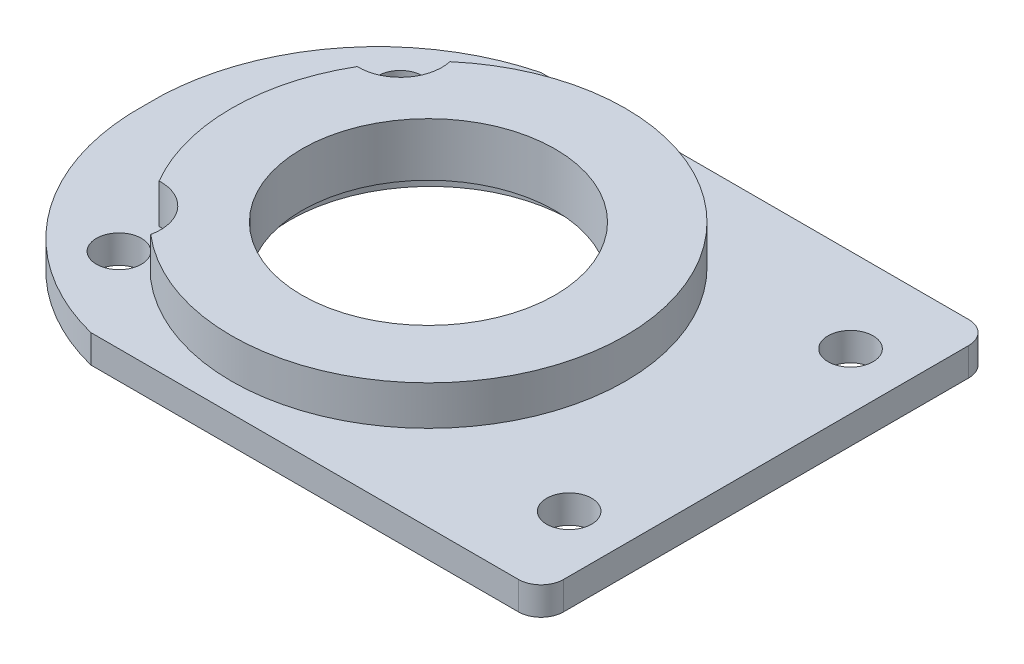
from build123d import *

# Parameters (mm, degrees)
SKETCH1_W               = 76.2
SKETCH1_H               = 50.8
SKETCH1_R               = 14.2748
BOSS_EXTRUDE1_DEPTH     = 3.175
SKETCH2_R               = 22.225
BOSS_EXTRUDE2_DEPTH     = 4.445
SKETCH4_R               = 15.8623
CUT_EXTRUDE2_DEPTH      = 1.6002
FILLET2_R               = 2.54
CUT_EXTRUDE3_DEPTH      = 92.688810795
CUT_EXTRUDE3_DEPTH_BACK = 92.688810795
SKETCH5_R               = 2.54
CUT_EXTRUDE4_DEPTH      = 92.688810795
SKETCH7_R               = 4.699
CUT_EXTRUDE5_DEPTH      = 92.688810795
SKETCH9_R               = 4.699
CUT_EXTRUDE6_DEPTH      = 92.688810795
CUT_EXTRUDE8_DEPTH      = 92.688810795
CUT_EXTRUDE8_DEPTH_BACK = 92.688810795
SKETCH3_R               = 14.2875


with BuildPart() as part:
    # Sketch1 → Boss-Extrude1 (new body)
    with BuildSketch(Plane(origin=(0, 0, 0), x_dir=(1, 0, 0), z_dir=(0, 1, 0))):
        with Locations((38.1, 25.4)):
            Rectangle(SKETCH1_W, SKETCH1_H)
        with Locations((38.1, 25.4)):
            Circle(SKETCH1_R, mode=Mode.SUBTRACT)
    extrude(amount=BOSS_EXTRUDE1_DEPTH)

    # Sketch2 → Boss-Extrude2 (add)
    with BuildSketch(Plane(origin=(0, 3.175, 0), x_dir=(1, 0, 0), z_dir=(0, 1, 0))):
        with Locations((38.1, 25.4)):
            Circle(SKETCH2_R)
    extrude(amount=BOSS_EXTRUDE2_DEPTH)

    # Sketch4 → Cut-Extrude2 (cut)
    with BuildSketch(Plane(origin=(0, 0, 0), x_dir=(-1, 0, 0), z_dir=(0, -1, 0))):
        with Locations((-38.332507849, 25.4)):
            Circle(SKETCH4_R)
    extrude(amount=-CUT_EXTRUDE2_DEPTH, mode=Mode.SUBTRACT)

    # Fillet2
    fillet2_edges = [part.edges().sort_by_distance(p)[0] for p in [
        (0, 1.5875, -50.8),
        (76.2, 1.5875, -50.8),
        (0, 1.5875, 0),
        (76.2, 1.5875, 0),
    ]]
    fillet(fillet2_edges, radius=FILLET2_R)

    # Sketch5 → Cut-Extrude3 (cut, two sides: drawn at the far end of the back side and taken through both)
    with BuildSketch(Plane(origin=(0, 3.175, 0), x_dir=(1, 0, 0), z_dir=(0, 1, 0)).offset(-CUT_EXTRUDE3_DEPTH_BACK)):
        with Locations((69.85, 41.275)):
            Circle(SKETCH5_R)
        with Locations((69.85, 9.525)):
            Circle(SKETCH5_R)
        with Locations((19.05, 9.525)):
            Circle(SKETCH5_R)
        with Locations((19.05, 41.275)):
            Circle(SKETCH5_R)
    extrude(amount=CUT_EXTRUDE3_DEPTH + CUT_EXTRUDE3_DEPTH_BACK, mode=Mode.SUBTRACT)

    # Sketch6 → Cut-Extrude4 (cut, through all)
    with BuildSketch(Plane(origin=(0, 3.175, 0), x_dir=(1, 0, 0), z_dir=(0, 1, 0))):
        with BuildLine():
            Line((0, 48.26), (0, 2.54))
            ThreePointArc((0, 2.54), (0.743948776, 0.743948776), (2.54, 0))
            Line((2.54, 0), (25.399999995, 0))
            ThreePointArc((25.399999995, 0), (11.359611147, 9.31110396), (6.233986574, 25.359691084))
            ThreePointArc((6.233986574, 25.359691084), (11.333824667, 41.457338196), (25.399999042, 50.8))
            Line((25.399999042, 50.8), (2.54, 50.8))
            ThreePointArc((2.54, 50.8), (0.743948776, 50.056051224), (0, 48.26))
        make_face()
    extrude(amount=-CUT_EXTRUDE4_DEPTH, mode=Mode.SUBTRACT)

    # Sketch7 → Cut-Extrude5 (cut, through all)
    with BuildSketch(Plane(origin=(0, 3.175, 0), x_dir=(1, 0, 0), z_dir=(0, 1, 0))):
        with Locations((19.05, 9.525)):
            Circle(SKETCH7_R)
    extrude(amount=CUT_EXTRUDE5_DEPTH, mode=Mode.SUBTRACT)

    # Sketch9 → Cut-Extrude6 (cut, through all)
    with BuildSketch(Plane(origin=(0, 3.175, 0), x_dir=(1, 0, 0), z_dir=(0, 1, 0))):
        with Locations((19.05, 41.275)):
            Circle(SKETCH9_R)
    extrude(amount=CUT_EXTRUDE6_DEPTH, mode=Mode.SUBTRACT)

    # Sketch3 → Cut-Extrude8 (cut, two sides: drawn at the far end of the back side and taken through both)
    with BuildSketch(Plane.XZ.offset(-3.175).offset(-CUT_EXTRUDE8_DEPTH_BACK)):
        with Locations((38.1, -25.4)):
            Circle(SKETCH3_R)
    extrude(amount=CUT_EXTRUDE8_DEPTH + CUT_EXTRUDE8_DEPTH_BACK, mode=Mode.SUBTRACT)


solid = part.part
